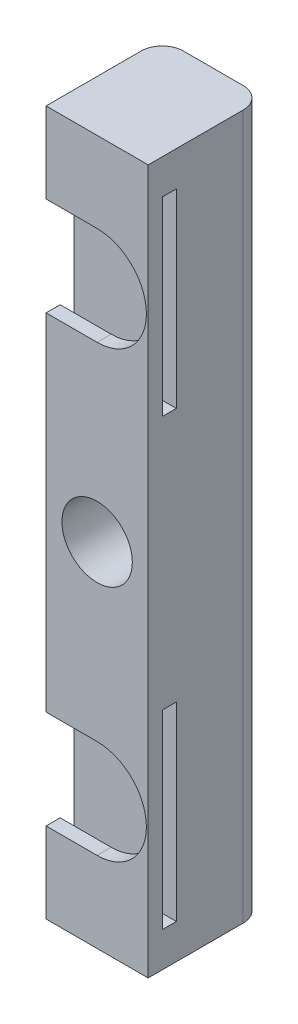
from build123d import *

# Parameters (mm, degrees)
SKETCH7_W           = 100
SKETCH7_H           = 14.5
BOSS_EXTRUDE1_DEPTH = 16.5
SKETCH8_R           = 5
CUT_EXTRUDE2_DEPTH  = 13
CUT_EXTRUDE3_START  = -2
SKETCH9_W           = 27
SKETCH9_H           = 27
CUT_EXTRUDE3_DEPTH  = 2
CUT_EXTRUDE4_DEPTH  = 2
FILLET1_R           = 3
FILLET2_R           = 3


with BuildPart() as part:
    # Sketch7 → Boss-Extrude1 (new body)
    with BuildSketch(Plane(origin=(0, 0, 0), x_dir=(0, 1, 0), z_dir=(0, 0, 1))):
        Rectangle(SKETCH7_W, SKETCH7_H)
    extrude(amount=BOSS_EXTRUDE1_DEPTH)

    # Sketch8 → Cut-Extrude2 (cut)
    with BuildSketch(Plane(origin=(0, 0, 16.5), x_dir=(0, -1, 0), z_dir=(0, 0, 1))):
        Circle(SKETCH8_R)
    extrude(amount=-CUT_EXTRUDE2_DEPTH, mode=Mode.SUBTRACT)

    # Sketch9 → Cut-Extrude3 (cut)
    with BuildSketch(Plane.XY.offset(16.5).offset(CUT_EXTRUDE3_START)):
        with Locations((0, -31.55)):
            Rectangle(SKETCH9_W, SKETCH9_H)
    cut_extrude3 = extrude(amount=-CUT_EXTRUDE3_DEPTH, mode=Mode.SUBTRACT)

    # Sketch10 → Cut-Extrude4 (cut)
    with BuildSketch(Plane.XY.offset(16.5)):
        with BuildLine():
            Line((0, -24.55), (-7.25, -24.55))
            Line((-7.25, -24.55), (-7.25, -38.55))
            Line((-7.25, -38.55), (0, -38.55))
            ThreePointArc((0, -38.55), (7, -31.55), (0, -24.55))
        make_face()
    cut_extrude4 = extrude(amount=-CUT_EXTRUDE4_DEPTH, mode=Mode.SUBTRACT)

    # Mirror1: Cut-Extrude3 across plane
    add(cut_extrude3.mirror(Plane.ZX), mode=Mode.SUBTRACT)

    # Mirror2: Cut-Extrude4 across plane
    add(cut_extrude4.mirror(Plane.ZX), mode=Mode.SUBTRACT)

    # Fillet1
    fillet1_edges = [part.edges().sort_by_distance(p)[0] for p in [
        (-7.25, 0, 0),
    ]]
    fillet(fillet1_edges, radius=FILLET1_R)

    # Fillet2
    fillet2_edges = [part.edges().sort_by_distance(p)[0] for p in [
        (7.25, 0, 0),
    ]]
    fillet(fillet2_edges, radius=FILLET2_R)


solid = part.part
